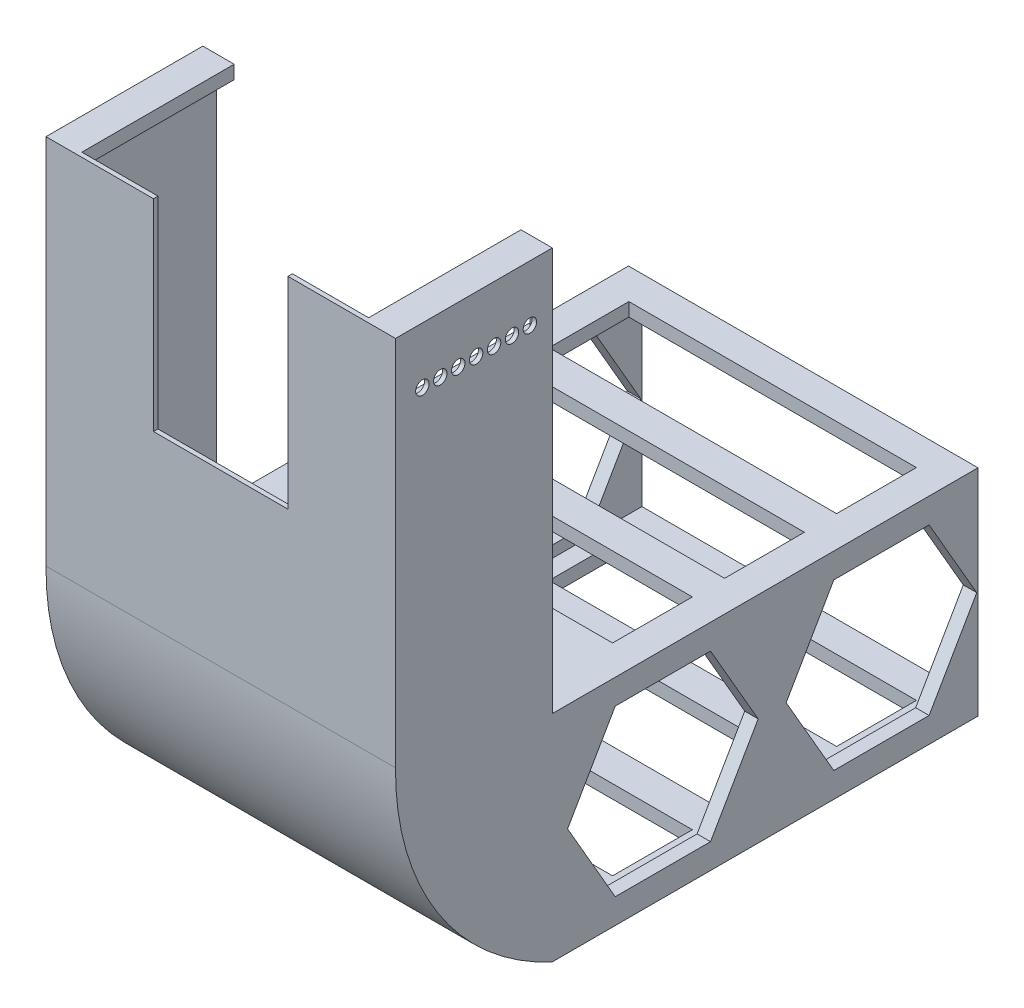
from build123d import *

# Parameters (mm, degrees)
BOUNDARY2_START       = -200
BOUNDARY2_OUTLINE_W   = 78
BOUNDARY2_OUTLINE_H   = 48
BOUNDARY2_OUTLINE_W_2 = 72
BOUNDARY2_OUTLINE_H_2 = 42
BOUNDARY2_DEPTH       = 200
BOSS_EXTRUDE1_DEPTH   = 78
CUT_EXTRUDE7_DEPTH    = 72
SKETCH9_W             = 1
SKETCH9_H             = 83
BOSS_EXTRUDE2_DEPTH   = 78
SKETCH10_W            = 34
SKETCH10_H            = 83
BOSS_EXTRUDE3_DEPTH   = 3
SKETCH11_W            = 34
SKETCH11_H            = 83
BOSS_EXTRUDE4_DEPTH   = 3
SKETCH12_W            = 30
SKETCH12_H            = 30
CUT_EXTRUDE8_DEPTH    = 2
SKETCH13_R            = 1.5
CUT_EXTRUDE9_DEPTH    = 2
SKETCH14_W            = 30
SKETCH14_H            = 29.06458826
CUT_EXTRUDE10_DEPTH   = 45
CUT_EXTRUDE14_DEPTH   = 102
SKETCH19_W            = 64.171404934
SKETCH19_H            = 17.809337631
CUT_EXTRUDE15_DEPTH   = 102
SKETCH22_W            = 34
SKETCH22_H            = 3
BOSS_EXTRUDE5_DEPTH   = 4
SKETCH23_W            = 34
SKETCH23_H            = 3
BOSS_EXTRUDE6_DEPTH   = 4
IZIM1_W               = 78
IZIM1_H               = 48
IZIM1_W_2             = 72
IZIM1_H_2             = 42
KES_EKSTR_ZYON2_DEPTH = 105


# Read off the part's stored shape, not the designer's step: Boundary2
with BuildPart() as part:
    # Boundary2 outline → Boundary2 (new body)
    with BuildSketch(Plane.XY.offset(BOUNDARY2_START)):
        Rectangle(BOUNDARY2_OUTLINE_W, BOUNDARY2_OUTLINE_H)
        Rectangle(BOUNDARY2_OUTLINE_W_2, BOUNDARY2_OUTLINE_H_2, mode=Mode.SUBTRACT)
    extrude(amount=BOUNDARY2_DEPTH)

    # Sketch4 → Boss-Extrude1 (add)
    with BuildSketch(Plane.ZY.offset(39)):
        with BuildLine():
            Line((35, 31), (0, 31))
            Line((0, 31), (0, -24))
            ThreePointArc((0, -24), (25.621419403, -1.668175984), (35, 31))
        make_face()
    extrude(amount=-BOSS_EXTRUDE1_DEPTH)

    # Sketch7 → Cut-Extrude7 (cut)
    with BuildSketch(Plane(origin=(36, 0, 0), x_dir=(0, 0, -1), z_dir=(1, 0, 0))):
        with BuildLine():
            Line((-34, 31), (0, 31))
            Line((0, 31), (0, -21))
            ThreePointArc((0, -21), (-23.813697573, 0.544890049), (-34, 31))
        make_face()
    extrude(amount=-CUT_EXTRUDE7_DEPTH, mode=Mode.SUBTRACT)

    # Sketch9 → Boss-Extrude2 (add)
    with BuildSketch(Plane.ZY.offset(39)):
        with Locations((34.5, 72.5)):
            Rectangle(SKETCH9_W, SKETCH9_H)
    extrude(amount=-BOSS_EXTRUDE2_DEPTH)

    # Sketch10 → Boss-Extrude3 (add)
    with BuildSketch(Plane(origin=(39, 0, 0), x_dir=(0, 0, -1), z_dir=(1, 0, 0))):
        with Locations((-17, 72.5)):
            Rectangle(SKETCH10_W, SKETCH10_H)
    extrude(amount=-BOSS_EXTRUDE3_DEPTH)

    # Sketch11 → Boss-Extrude4 (add)
    with BuildSketch(Plane.ZY.offset(39)):
        with Locations((17, 72.5)):
            Rectangle(SKETCH11_W, SKETCH11_H)
    extrude(amount=-BOSS_EXTRUDE4_DEPTH)

    # Sketch12 → Cut-Extrude8 (cut)
    with BuildSketch(Plane.ZY.offset(-36)):
        with Locations((17, 89)):
            Rectangle(SKETCH12_W, SKETCH12_H)
    extrude(amount=-CUT_EXTRUDE8_DEPTH, mode=Mode.SUBTRACT)

    # Sketch13 → Cut-Extrude9 (cut)
    with BuildSketch(Plane.ZY.offset(-38)):
        with Locations((5, 101.5)):
            Circle(SKETCH13_R)
        with Locations((9, 101.5)):
            Circle(SKETCH13_R)
        with Locations((13, 101.5)):
            Circle(SKETCH13_R)
        with Locations((17, 101.5)):
            Circle(SKETCH13_R)
        with Locations((21, 101.5)):
            Circle(SKETCH13_R)
        with Locations((25, 101.5)):
            Circle(SKETCH13_R)
        with Locations((29, 101.5)):
            Circle(SKETCH13_R)
    extrude(amount=-CUT_EXTRUDE9_DEPTH, mode=Mode.SUBTRACT)

    # Sketch14 → Cut-Extrude10 (cut)
    with BuildSketch(Plane(origin=(0, 114, 0), x_dir=(1, 0, 0), z_dir=(0, 1, 0))):
        with Locations((0, -34)):
            Rectangle(SKETCH14_W, SKETCH14_H)
    extrude(amount=-CUT_EXTRUDE10_DEPTH, mode=Mode.SUBTRACT)

    # Sketch17 → Cut-Extrude14 (cut)
    with BuildSketch(Plane.ZY.offset(39)):
        Polygon((-100.968873407, 0), (-111.602076583, 18.417248148), (-132.868482935, 18.417248148), (-143.501686111, 0), (-132.868482935, -18.417248148), (-111.602076583, -18.417248148), align=None)
        Polygon((-149.750833218, 0), (-160.384036394, 18.417248148), (-181.650442746, 18.417248148), (-192.283645923, 0), (-181.650442746, -18.417248148), (-160.384036394, -18.417248148), align=None)
        Polygon((-52.186913596, 0), (-62.820116772, 18.417248148), (-84.086523124, 18.417248148), (-94.7197263, 0), (-84.086523124, -18.417248148), (-62.820116772, -18.417248148), align=None)
        Polygon((-3.404953785, 0), (-14.038156961, 18.417248148), (-35.304563313, 18.417248148), (-45.937766489, 0), (-35.304563313, -18.417248148), (-14.038156961, -18.417248148), align=None)
    extrude(amount=-CUT_EXTRUDE14_DEPTH, mode=Mode.SUBTRACT)

    # Sketch19 → Cut-Extrude15 (cut)
    with BuildSketch(Plane(origin=(0, 24, 0), x_dir=(1, 0, 0), z_dir=(0, 1, 0))):
        with Locations((0, 154.262884124)):
            Rectangle(SKETCH19_W, SKETCH19_H)
        with Locations((0, 179.262884124)):
            Rectangle(SKETCH19_W, SKETCH19_H)
        with Locations((0, 129.262884124)):
            Rectangle(SKETCH19_W, SKETCH19_H)
        with Locations((0, 104.262884124)):
            Rectangle(SKETCH19_W, SKETCH19_H)
        with Locations((0, 79.262884124)):
            Rectangle(SKETCH19_W, SKETCH19_H)
        with Locations((0, 54.262884124)):
            Rectangle(SKETCH19_W, SKETCH19_H)
        with Locations((0, 29.262884124)):
            Rectangle(SKETCH19_W, SKETCH19_H)
    extrude(amount=-CUT_EXTRUDE15_DEPTH, mode=Mode.SUBTRACT)

    # Sketch22 → Boss-Extrude5 (add)
    with BuildSketch(Plane(origin=(-36, 0, 0), x_dir=(0, 0, -1), z_dir=(1, 0, 0))):
        with Locations((-17, 112.5)):
            Rectangle(SKETCH22_W, SKETCH22_H)
    extrude(amount=BOSS_EXTRUDE5_DEPTH)

    # Sketch23 → Boss-Extrude6 (add)
    with BuildSketch(Plane.ZY.offset(-36)):
        with Locations((17, 112.5)):
            Rectangle(SKETCH23_W, SKETCH23_H)
    extrude(amount=BOSS_EXTRUDE6_DEPTH)

    # Çizim1 → Kes-Ekstrüzyon2 (cut)
    with BuildSketch(Plane(origin=(0, 0, -200), x_dir=(-1, 0, 0), z_dir=(0, 0, -1))):
        Rectangle(IZIM1_W, IZIM1_H)
        Rectangle(IZIM1_W_2, IZIM1_H_2, mode=Mode.SUBTRACT)
    extrude(amount=-KES_EKSTR_ZYON2_DEPTH, mode=Mode.SUBTRACT)


solid = part.part
